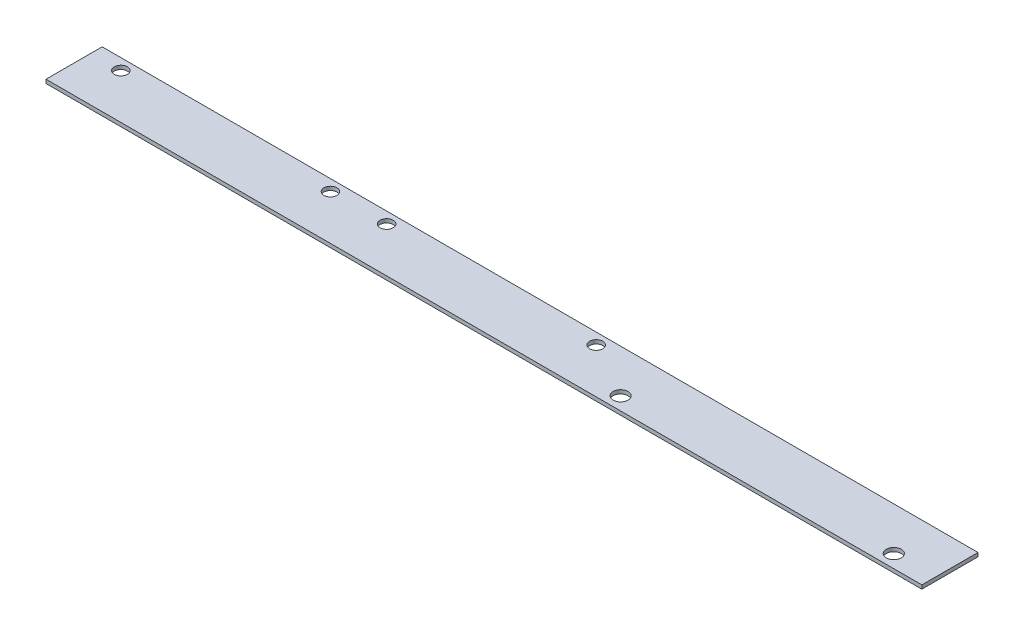
from build123d import *

# Parameters (mm, degrees)
SKETCH_1_W      = 234
SKETCH_1_H      = 15
SKETCH_1_R      = 2
SKETCH_1_R_2    = 1.75
EXTRUDE_1_DEPTH = 1


with BuildPart() as part:
    # Эскиз1 → Бобышка-Вытянуть1 (new body)
    with BuildSketch(Plane(origin=(0, 0, 0), x_dir=(1, 0, 0), z_dir=(0, 1, 0))):
        with Locations((117, 7.5)):
            Rectangle(SKETCH_1_W, SKETCH_1_H)
        with Locations((150, 3.5)):
            Circle(SKETCH_1_R, mode=Mode.SUBTRACT)
        with Locations((64, 12)):
            Circle(SKETCH_1_R_2, mode=Mode.SUBTRACT)
        with Locations((8, 12)):
            Circle(SKETCH_1_R_2, mode=Mode.SUBTRACT)
        with Locations((79, 12)):
            Circle(SKETCH_1_R_2, mode=Mode.SUBTRACT)
        with Locations((135, 12)):
            Circle(SKETCH_1_R_2, mode=Mode.SUBTRACT)
        with Locations((223, 3.5)):
            Circle(SKETCH_1_R, mode=Mode.SUBTRACT)
    extrude(amount=EXTRUDE_1_DEPTH)


solid = part.part
